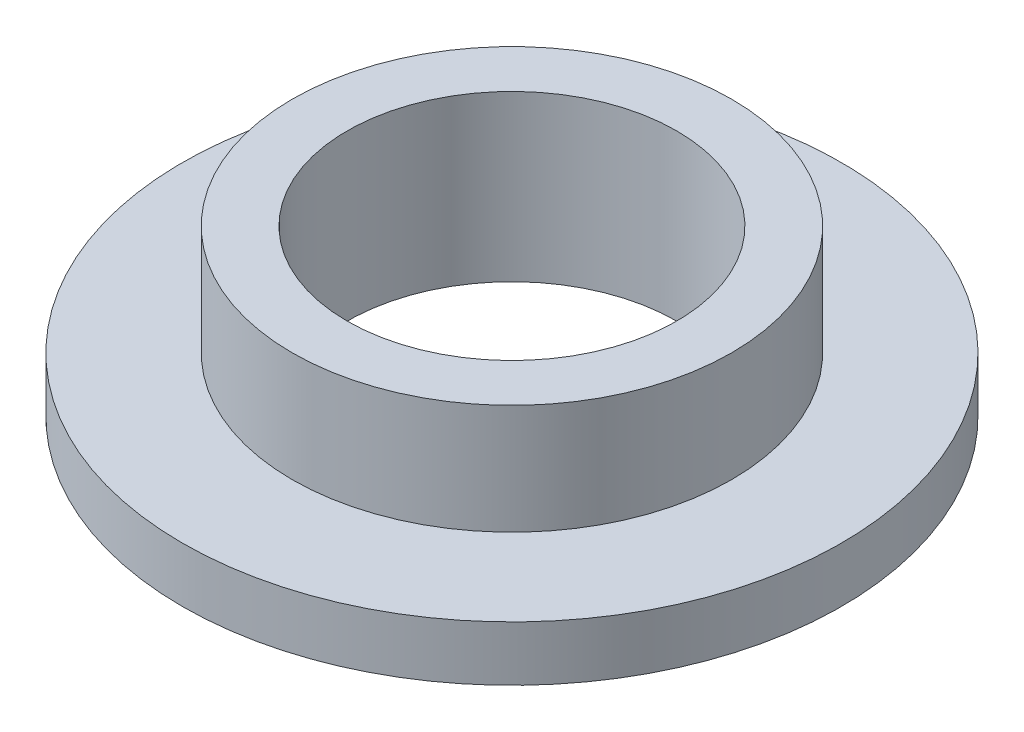
from build123d import *

# Parameters (mm, degrees)
SKETCH2_R           = 19.05
BOSS_EXTRUDE1_DEPTH = 3.175
SKETCH3_R           = 12.7
BOSS_EXTRUDE2_DEPTH = 6.35
SKETCH4_R           = 9.525
CUT_EXTRUDE1_DEPTH  = 29.575


with BuildPart() as part:
    # Sketch2 → Boss-Extrude1 (new body)
    with BuildSketch(Plane(origin=(0, 0, 0), x_dir=(1, 0, 0), z_dir=(0, 1, 0))):
        Circle(SKETCH2_R)
    extrude(amount=BOSS_EXTRUDE1_DEPTH)

    # Sketch3 → Boss-Extrude2 (add)
    with BuildSketch(Plane(origin=(0, 3.175, 0), x_dir=(1, 0, 0), z_dir=(0, 1, 0))):
        Circle(SKETCH3_R)
    extrude(amount=BOSS_EXTRUDE2_DEPTH)

    # Sketch4 → Cut-Extrude1 (cut, through all)
    with BuildSketch(Plane(origin=(0, 9.525, 0), x_dir=(1, 0, 0), z_dir=(0, 1, 0))):
        Circle(SKETCH4_R)
    extrude(amount=-CUT_EXTRUDE1_DEPTH, mode=Mode.SUBTRACT)


solid = part.part
